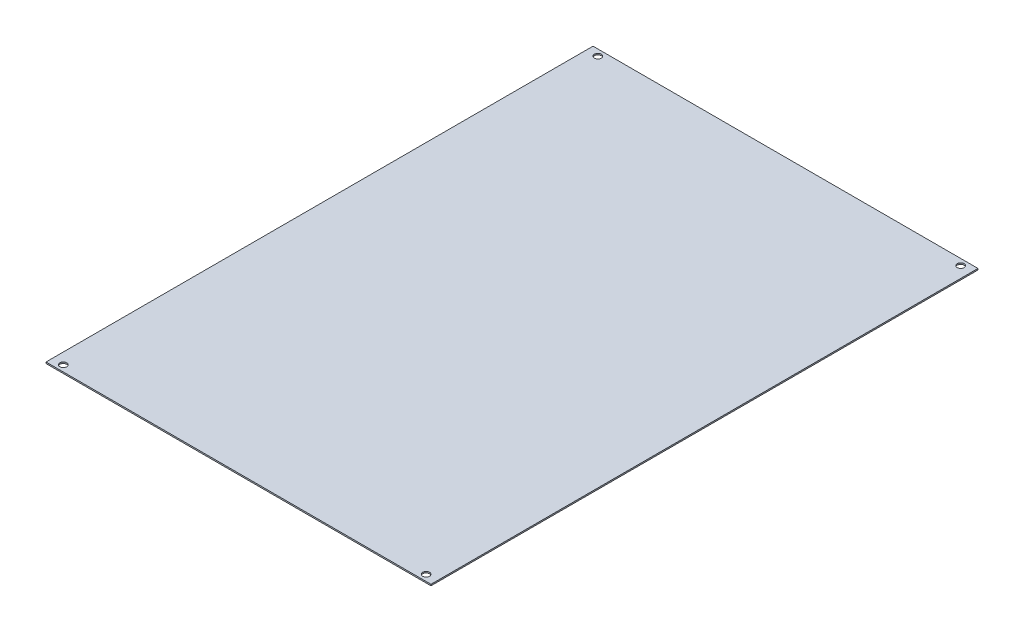
from build123d import *

# Parameters (mm, degrees)
SKETCH1_W          = 278
SKETCH1_H          = 395
BASE_FLANGE1_DEPTH = 1
SKETCH6_R          = 2.5
SCREW_DEPTH        = 242.512422041


# Sheet-metal steps are written as plain solids
with BuildPart() as part:
    # Sketch1 → Base-Flange1 (new body)
    with BuildSketch(Plane(origin=(0, 0, 0), x_dir=(1, 0, 0), z_dir=(0, 1, 0))):
        Rectangle(SKETCH1_W, SKETCH1_H)
    extrude(amount=-BASE_FLANGE1_DEPTH)

    # Sketch6 → Screw (cut, through all)
    with BuildSketch(Plane(origin=(0, 0, 0), x_dir=(1, 0, 0), z_dir=(0, 1, 0))):
        with Locations(Location((-131, 193, 0), (0, 0, 270))):
            Circle(SKETCH6_R)
        with Locations(Location((131, 193, 0), (0, 0, 270))):
            Circle(SKETCH6_R)
        with Locations(Location((131, -193, 0), (0, 0, 270))):
            Circle(SKETCH6_R)
        with Locations(Location((-131, -193, 0), (0, 0, 270))):
            Circle(SKETCH6_R)
    extrude(amount=-SCREW_DEPTH, mode=Mode.SUBTRACT)


solid = part.part
